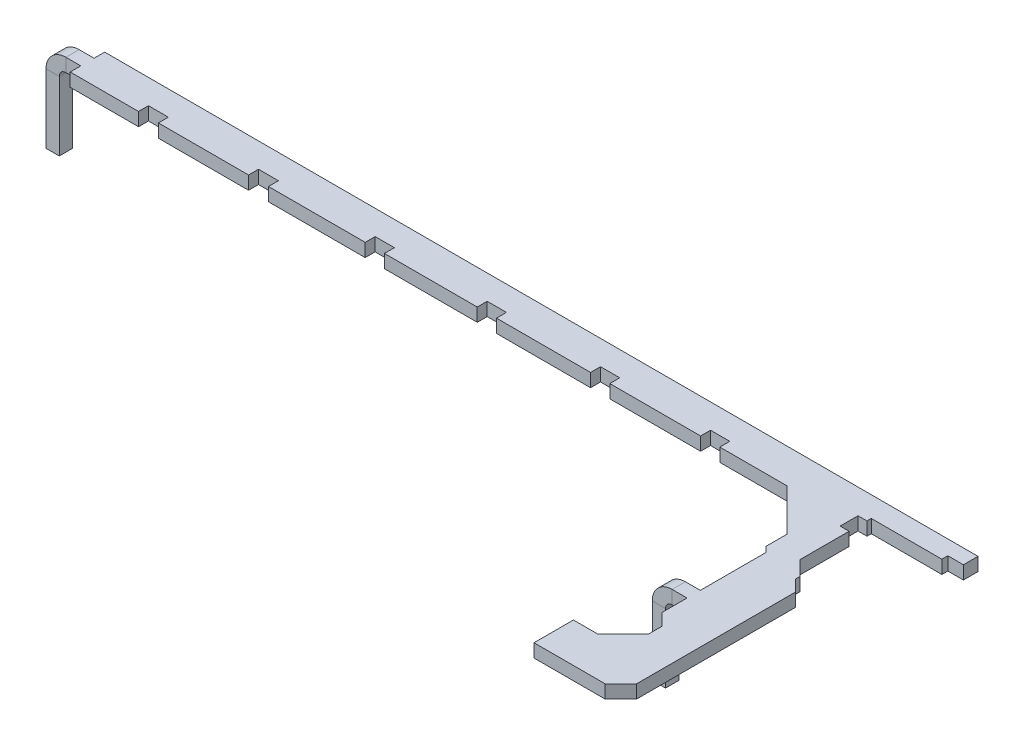
from build123d import *

# Parameters (mm, degrees)
SKETCH1_W           = 2.25
SKETCH1_H           = 2
BOSS_EXTRUDE1_DEPTH = 2
SKETCH12_W          = 3
SKETCH12_H          = 2.15
SKETCH12_W_2        = 2.99999908
SKETCH12_W_3        = 2.89999928
SKETCH12_W_4        = 2
SKETCH12_H_2        = 2.69999968
SKETCH12_H_3        = 2
CUT_EXTRUDE1_DEPTH  = 10
EDGE_FLANGE1_DEPTH  = 2
EDGE_FLANGE2_DEPTH  = 2


# Sheet-metal steps are written as plain solids
with BuildPart() as part:
    # Sketch1 → Boss-Extrude1 (new body)
    with BuildSketch(Plane(origin=(0, 0, 0), x_dir=(1, 0, 0), z_dir=(0, 1, 0))):
        with Locations((47.911990623, -24.171897133)):
            Rectangle(SKETCH1_W, SKETCH1_H)
        with Locations((-67.346417942, -0.378635375)):
            Rectangle(SKETCH1_W, SKETCH1_H)
        Polygon((49.036990623, -28.925083001), (49.036990623, -13.225081484), (48.236992223, -12.425083084), (48.236992223, -9.325081664), (41.890545314, -2.978634755), (-54.913007717, -2.978634755), (-66.221417942, -2.978634755), (-66.221417942, 2.221364005), (-54.913007717, 2.221364005), (65.536992183, 2.221364005), (65.536992183, -0.878636415), (52.536992783, -0.878636415), (52.536992783, -11.632189325), (54.736991299, -13.832187841), (54.736993839, -14.532188981), (56.436992603, -16.232187745), (56.436992603, -40.185676156), (54.062239478, -42.560429281), (43.336991863, -42.560429281), (43.336991863, -36.616688347), (47.052491322, -36.616688347), (50.836992103, -32.832187565), (50.836992103, -30.725081941), align=None)
    extrude(amount=BOSS_EXTRUDE1_DEPTH)

    # Sketch12 → Cut-Extrude1 (cut)
    with BuildSketch(Plane(origin=(0, 2, 0), x_dir=(1, 0, 0), z_dir=(0, 1, 0))):
        with Locations((-54.413012042, -2.553635995)):
            Rectangle(SKETCH12_W, SKETCH12_H)
        with Locations((-37.813011762, -2.553635995)):
            Rectangle(SKETCH12_W_2, SKETCH12_H)
        with Locations((-20.263011302, -2.553635995)):
            Rectangle(SKETCH12_W_3, SKETCH12_H)
        with Locations((-3.363012082, -2.553635995)):
            Rectangle(SKETCH12_W_3, SKETCH12_H)
        with Locations((13.736989278, -2.553635995)):
            Rectangle(SKETCH12_W_3, SKETCH12_H)
        with Locations((30.336989098, -2.553635995)):
            Rectangle(SKETCH12_W_3, SKETCH12_H)
        with Locations((52.186988038, -2.878639758)):
            Rectangle(SKETCH12_W_4, SKETCH12_H_2)
        with Locations((64.636989078, -0.978635995)):
            Rectangle(SKETCH12_W_3, SKETCH12_H_3)
    extrude(amount=-CUT_EXTRUDE1_DEPTH, mode=Mode.SUBTRACT)

    # Edge-Flange1 section (across the edge) → Edge-Flange1 (add)
    with BuildSketch(Plane(origin=(-69.471417942, 0, 1.378635375), x_dir=(1, 0, 0), z_dir=(0, 0, -1))):
        with BuildLine():
            Line((-2, 1), (-2, 11.4))
            Line((-2, 11.4), (0, 11.4))
            Line((0, 11.4), (0, 1))
            ThreePointArc((0, 1), (0.292893219, 0.292893219), (1, 0))
            Line((1, 0), (1, -2))
            ThreePointArc((1, -2), (-1.121320344, -1.121320344), (-2, 1))
        make_face()
    extrude(amount=EDGE_FLANGE1_DEPTH)

    # Edge-Flange2 section (across the edge) → Edge-Flange2 (add)
    with BuildSketch(Plane(origin=(45.786990623, 0, 25.171897133), x_dir=(1, 0, 0), z_dir=(0, 0, -1))):
        with BuildLine():
            Line((-2, 1), (-2, 11.4))
            Line((-2, 11.4), (0, 11.4))
            Line((0, 11.4), (0, 1))
            ThreePointArc((0, 1), (0.292893219, 0.292893219), (1, 0))
            Line((1, 0), (1, -2))
            ThreePointArc((1, -2), (-1.121320344, -1.121320344), (-2, 1))
        make_face()
    extrude(amount=EDGE_FLANGE2_DEPTH)


solid = part.part
